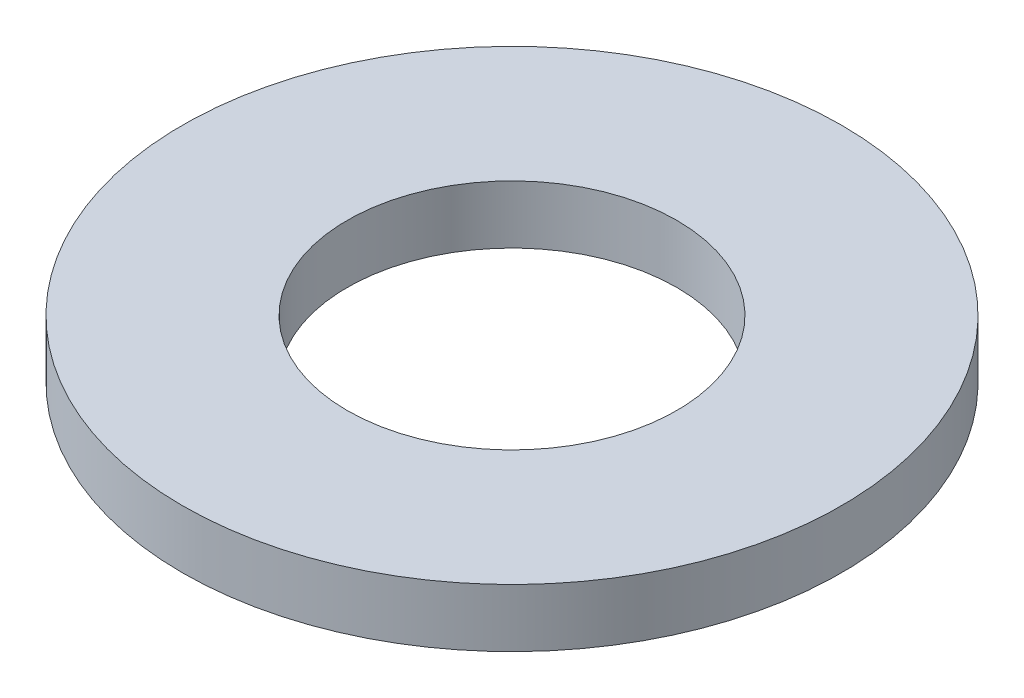
from build123d import *

# Parameters (mm, degrees)
SKETCH1_R           = 85
BOSS_EXTRUDE1_DEPTH = 15
SKETCH2_R           = 42.5
CUT_EXTRUDE1_DEPTH  = 122.140414396


with BuildPart() as part:
    # Sketch1 → Boss-Extrude1 (new body)
    with BuildSketch(Plane(origin=(0, 0, 0), x_dir=(1, 0, 0), z_dir=(0, 1, 0))):
        Circle(SKETCH1_R)
    extrude(amount=BOSS_EXTRUDE1_DEPTH)

    # Sketch2 → Cut-Extrude1 (cut, through all)
    with BuildSketch(Plane(origin=(0, 0, 0), x_dir=(1, 0, 0), z_dir=(0, 1, 0))):
        Circle(SKETCH2_R)
    extrude(amount=CUT_EXTRUDE1_DEPTH, mode=Mode.SUBTRACT)


solid = part.part
